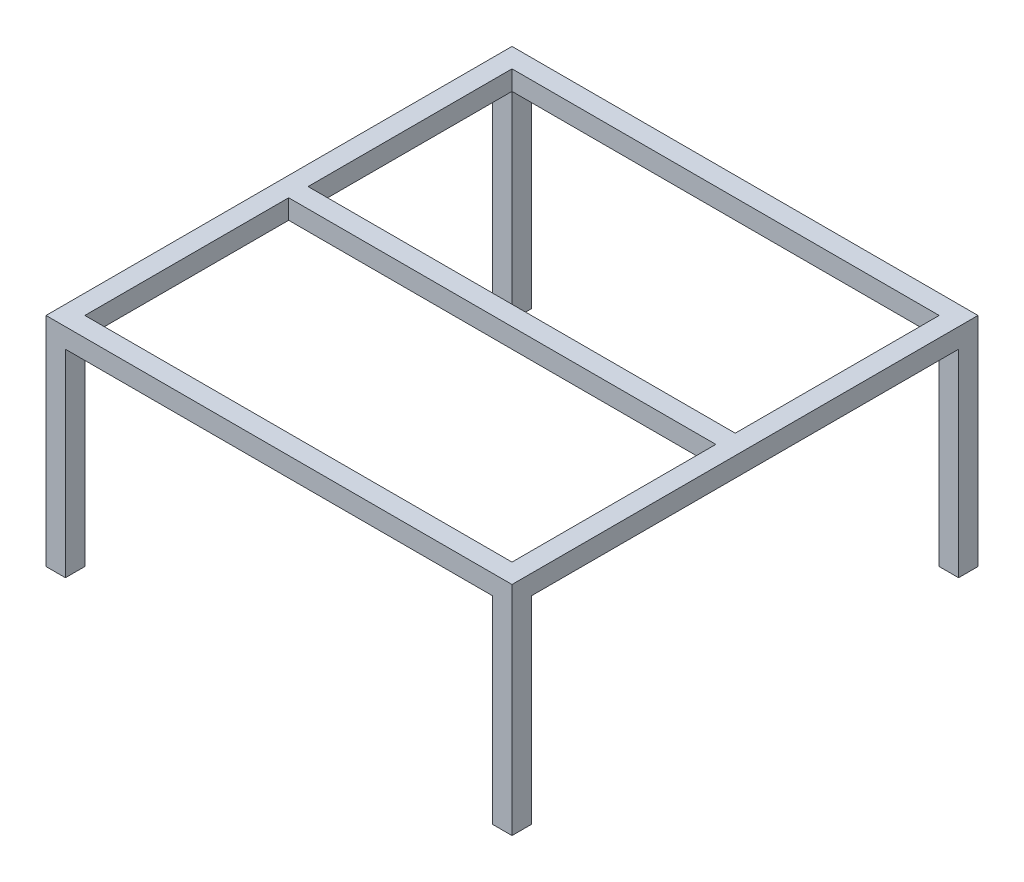
from build123d import *

# Parameters (mm, degrees)
STOCK_PLATE_BETA1_1_START       = 76.165904354
STOCK_PLATE_BETA1_1_OUTLINE_W   = 152.4
STOCK_PLATE_BETA1_1_OUTLINE_H   = 152.4
STOCK_PLATE_BETA1_1_OUTLINE_W_2 = 139.7
STOCK_PLATE_BETA1_1_OUTLINE_H_2 = 66.690053594
STOCK_PLATE_BETA1_1_OUTLINE_H_3 = 66.659946406
STOCK_PLATE_BETA1_1_DEPTH       = 6.384095646
STOCK_PLATE_BETA1_1_START_2     = 11.43
STOCK_PLATE_BETA1_1_2_OUTLINE_W = 6.35
STOCK_PLATE_BETA1_1_2_OUTLINE_H = 6.35
STOCK_PLATE_BETA1_1_2_DEPTH     = 64.735904354
SKETCH1_R                       = 1.59512
CUT_EXTRUDE2_DEPTH              = 8.89


# Read off the part's stored shape, not the designer's step: Stock-plate_beta1-1
with BuildPart() as part:
    # Stock-plate_beta1-1 outline → Stock-plate_beta1-1 (new body)
    with BuildSketch(Plane(origin=(0, 0, 0), x_dir=(1, 0, 0), z_dir=(0, 1, 0)).offset(STOCK_PLATE_BETA1_1_START)):
        with Locations((40.776583963, 45.362139437)):
            Rectangle(STOCK_PLATE_BETA1_1_OUTLINE_W, STOCK_PLATE_BETA1_1_OUTLINE_H)
        with Locations((40.776583963, 81.86711264)):
            Rectangle(STOCK_PLATE_BETA1_1_OUTLINE_W_2, STOCK_PLATE_BETA1_1_OUTLINE_H_2, mode=Mode.SUBTRACT)
        with Locations((40.776583963, 8.84211264)):
            Rectangle(STOCK_PLATE_BETA1_1_OUTLINE_W_2, STOCK_PLATE_BETA1_1_OUTLINE_H_3, mode=Mode.SUBTRACT)
    extrude(amount=STOCK_PLATE_BETA1_1_DEPTH)

    # Stock-plate_beta1-1 2 outline → Stock-plate_beta1-1 2 (add)
    with BuildSketch(Plane(origin=(0, 0, 0), x_dir=(1, 0, 0), z_dir=(0, 1, 0)).offset(STOCK_PLATE_BETA1_1_START_2)):
        with Locations((-32.248416037, 118.387139437)):
            Rectangle(STOCK_PLATE_BETA1_1_2_OUTLINE_W, STOCK_PLATE_BETA1_1_2_OUTLINE_H)
        with Locations((113.801583963, 118.387139437)):
            Rectangle(STOCK_PLATE_BETA1_1_2_OUTLINE_W, STOCK_PLATE_BETA1_1_2_OUTLINE_H)
        with Locations((-32.248416037, -27.662860563)):
            Rectangle(STOCK_PLATE_BETA1_1_2_OUTLINE_W, STOCK_PLATE_BETA1_1_2_OUTLINE_H)
        with Locations((113.801583963, -27.662860563)):
            Rectangle(STOCK_PLATE_BETA1_1_2_OUTLINE_W, STOCK_PLATE_BETA1_1_2_OUTLINE_H)
    extrude(amount=STOCK_PLATE_BETA1_1_2_DEPTH)

    # Sketch1 → Cut-Extrude2 (cut)
    with BuildSketch(Plane(origin=(0, 11.43, 0), x_dir=(-1, 0, 0), z_dir=(0, -1, 0))):
        with Locations(Location((32.248416037, -27.662860563, 0), (0, 0, 90))):
            Circle(SKETCH1_R)
        with Locations(Location((-113.801583963, -27.662860563, 0), (0, 0, 90))):
            Circle(SKETCH1_R)
        with Locations(Location((-113.801583963, 118.387139437, 0), (0, 0, 90))):
            Circle(SKETCH1_R)
        with Locations(Location((32.248416037, 118.387139437, 0), (0, 0, 90))):
            Circle(SKETCH1_R)
    extrude(amount=-CUT_EXTRUDE2_DEPTH, mode=Mode.SUBTRACT)


solid = part.part
